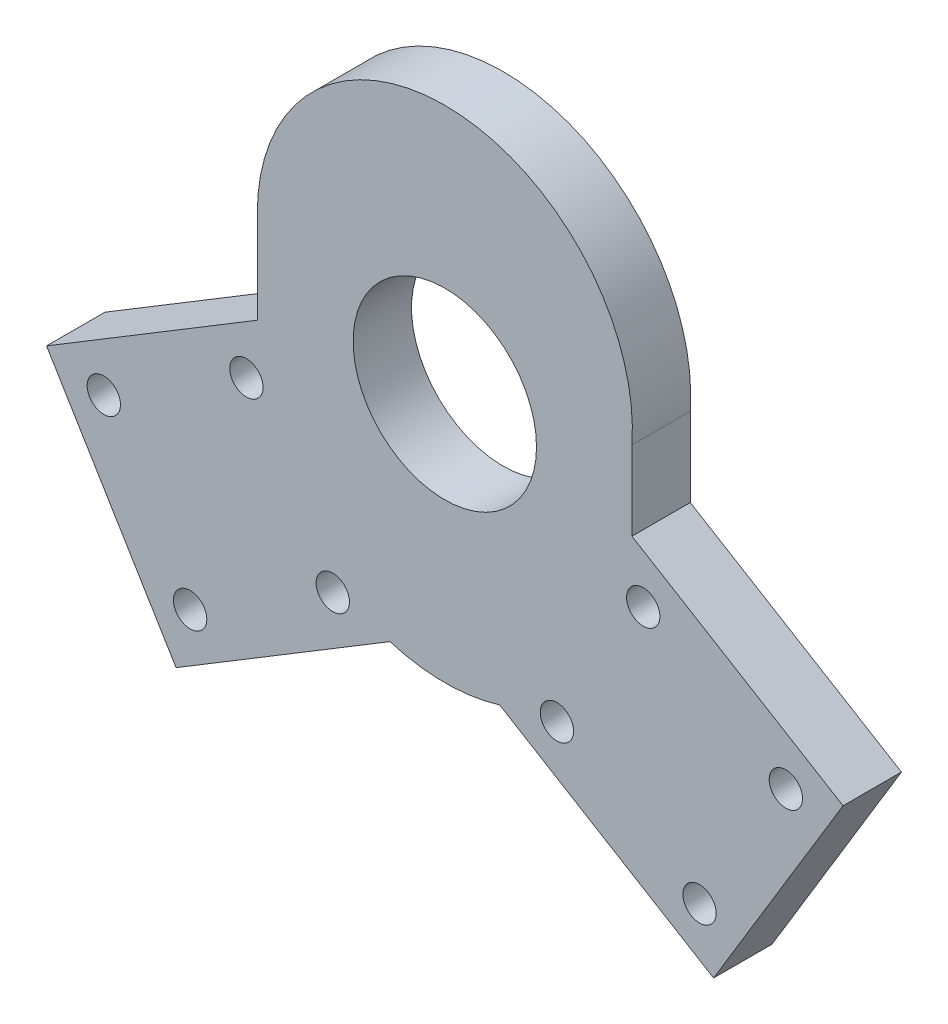
from build123d import *

# Parameters (mm, degrees)
SKETCH2_R           = 22.5
SKETCH2_W           = 44.944705062
SKETCH2_H           = 15
BOSS_EXTRUDE1_DEPTH = 7
SKETCH4_R           = 2
CUT_EXTRUDE1_DEPTH  = 10
SKETCH5_R           = 11
CUT_EXTRUDE2_DEPTH  = 10


with BuildPart() as part:
    # Sketch2 → Boss-Extrude1 (new body)
    with BuildSketch(Plane.XY):
        Circle(SKETCH2_R)
        with Locations((0, 15)):
            Circle(SKETCH2_R)
        Polygon((6.578363356, -21.516857009), (22.114553677, 4.146868175), (47.778278861, -11.389322146), (32.24208854, -37.05304733), align=None)
        Polygon((-6.578363356, -21.516857009), (-22.114553677, 4.146868175), (-47.778278861, -11.389322146), (-32.24208854, -37.05304733), align=None)
        with Locations((-0.027647469, 7.5)):
            Rectangle(SKETCH2_W, SKETCH2_H)
    extrude(amount=BOSS_EXTRUDE1_DEPTH)

    # Sketch4 → Cut-Extrude1 (cut)
    with BuildSketch(Plane.XY.offset(7)):
        with Locations((-40.911626277, -13.077244623)):
            Circle(SKETCH4_R)
        with Locations((-23.802476154, -2.719784409)):
            Circle(SKETCH4_R)
        with Locations((-13.44501594, -19.828934532)):
            Circle(SKETCH4_R)
        with Locations((-30.554166063, -30.186394746)):
            Circle(SKETCH4_R)
        with Locations((23.802476154, -2.719784409)):
            Circle(SKETCH4_R)
        with Locations((13.44501594, -19.828934532)):
            Circle(SKETCH4_R)
        with Locations((40.911626277, -13.077244623)):
            Circle(SKETCH4_R)
        with Locations((30.554166063, -30.186394746)):
            Circle(SKETCH4_R)
    extrude(amount=-CUT_EXTRUDE1_DEPTH, mode=Mode.SUBTRACT)

    # Sketch5 → Cut-Extrude2 (cut)
    with BuildSketch(Plane.XY.offset(7)):
        with Locations((0, 7.5)):
            Circle(SKETCH5_R)
    extrude(amount=-CUT_EXTRUDE2_DEPTH, mode=Mode.SUBTRACT)


solid = part.part
